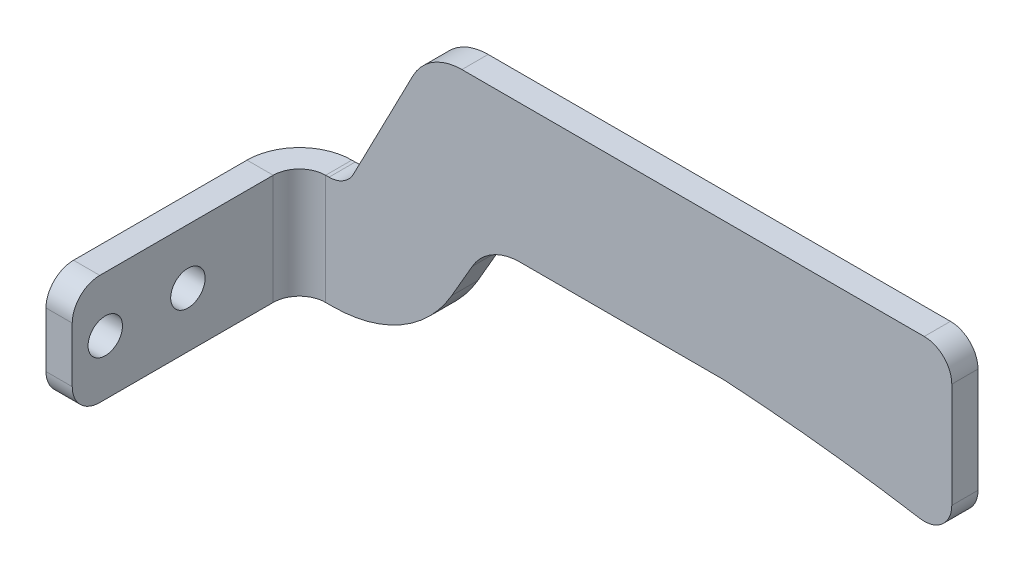
from build123d import *

# Parameters (mm, degrees)
SALIENTE_EXTRUIR1_DEPTH = 6.35
CONVERTIR_S_LIDO1_DEPTH = 1.59
BRIDA_DE_ARISTA1_DEPTH  = 20
REDONDEO1_R             = 5
CORTAR_EXTRUIR1_REACH   = 138.693
CROQUIS11_R             = 3.125


# Read off the part's stored shape, not the designer's step: Convertir-Sólido1
# Sheet-metal steps are written as plain solids
with BuildPart() as part:
    # Croquis1 → Saliente-Extruir1 (new body)
    with BuildSketch(Plane.XY):
        with BuildLine():
            Line((0, 0), (1.21624327, 0))
            ThreePointArc((1.21624327, 0), (13.71624327, 3.349364905), (22.866878365, 12.5))
            Line((22.866878365, 12.5), (26.608548116, 18.980762114))
            ThreePointArc((26.608548116, 18.980762114), (30.268802154, 22.641016151), (35.268802154, 23.980762114))
            Line((35.268802154, 23.980762114), (72.43532503, 23.980762114))
            ThreePointArc((72.43532503, 23.980762114), (90.187263937, 22.435296605), (107.837539609, 19.988345998))
            ThreePointArc((107.837539609, 19.988345998), (111.885560079, 21.109920556), (113.65, 24.921895239))
            Line((113.65, 24.921895239), (113.65, 43.980762114))
            ThreePointArc((113.65, 43.980762114), (112.185533906, 47.516296019), (108.65, 48.980762114))
            Line((108.65, 48.980762114), (24.734232406, 48.980762114))
            ThreePointArc((24.734232406, 48.980762114), (19.536461106, 47.523781106), (15.853300619, 43.577396815))
            Line((15.853300619, 43.577396815), (5.048349691, 22.701682649))
            ThreePointArc((5.048349691, 22.701682649), (3.206769447, 20.728490504), (0.607883797, 20))
            Line((0.607883797, 20), (0, 20))
            Line((0, 20), (0, 0))
        make_face()
    extrude(amount=SALIENTE_EXTRUIR1_DEPTH)

    # Convertir-Sólido1 outline → Convertir-Sólido1 (cut)
    with BuildSketch(Plane.XY):
        with BuildLine():
            Line((0, 20), (0, 0))
            Line((0, 0), (1.21624327, 0))
            ThreePointArc((1.21624327, 0), (13.71624327, 3.349364905), (22.866878365, 12.5))
            Line((22.866878365, 12.5), (26.608548116, 18.980762114))
            ThreePointArc((26.608548116, 18.980762114), (30.268802154, 22.641016151), (35.268802154, 23.980762114))
            Line((35.268802154, 23.980762114), (72.43532503, 23.980762114))
            ThreePointArc((72.43532503, 23.980762114), (90.187263937, 22.435296605), (107.837539609, 19.988345998))
            ThreePointArc((107.837539609, 19.988345998), (111.885560079, 21.109920556), (113.65, 24.921895239))
            Line((113.65, 24.921895239), (113.65, 43.980762114))
            ThreePointArc((113.65, 43.980762114), (112.185533906, 47.516296019), (108.65, 48.980762114))
            Line((108.65, 48.980762114), (24.734232406, 48.980762114))
            ThreePointArc((24.734232406, 48.980762114), (19.536461106, 47.523781106), (15.853300619, 43.577396815))
            Line((15.853300619, 43.577396815), (5.048349691, 22.701682649))
            ThreePointArc((5.048349691, 22.701682649), (3.206769447, 20.728490504), (0.607883797, 20))
            Line((0.607883797, 20), (0, 20))
        make_face()
    extrude(amount=CONVERTIR_S_LIDO1_DEPTH, mode=Mode.SUBTRACT)

    # Brida de arista1 section (across the edge) → Brida de arista1 (add)
    with BuildSketch(Plane(origin=(-4.76, 20, 6.35), x_dir=(1, 0, 0), z_dir=(0, -1, 0))):
        with BuildLine():
            Line((-4.76, 4.76), (-4.76, 41.24))
            Line((-4.76, 41.24), (0, 41.24))
            Line((0, 41.24), (0, 4.76))
            ThreePointArc((0, 4.76), (1.394171722, 1.394171722), (4.76, 0))
            Line((4.76, 0), (4.76, -4.76))
            ThreePointArc((4.76, -4.76), (-1.971656557, -1.971656557), (-4.76, 4.76))
        make_face()
    extrude(amount=BRIDA_DE_ARISTA1_DEPTH)

    # Redondeo1
    redondeo1_edges = [part.edges().sort_by_distance(p)[0] for p in [
        (-7.14, 20, 47.59),
        (-7.14, 0, 47.59),
    ]]
    fillet(redondeo1_edges, radius=REDONDEO1_R)

    # Croquis11 → Cortar-Extruir1 (cut, up to next)
    with BuildSketch(Plane(origin=(-4.76, 0, 0), x_dir=(0, 0, -1), z_dir=(1, 0, 0)), mode=Mode.PRIVATE) as cortar_extruir1_sk1:
        with Locations((-41.59, 10)):
            Circle(CROQUIS11_R)
    cortar_extruir1_tool1 = extrude(cortar_extruir1_sk1.sketch, amount=-CORTAR_EXTRUIR1_REACH, mode=Mode.PRIVATE) & part.part
    # Croquis11 → Cortar-Extruir1 (cut, up to next)
    with BuildSketch(Plane(origin=(-4.76, 0, 0), x_dir=(0, 0, -1), z_dir=(1, 0, 0)), mode=Mode.PRIVATE) as cortar_extruir1_sk2:
        with Locations((-26.59, 10)):
            Circle(CROQUIS11_R)
    cortar_extruir1_tool2 = extrude(cortar_extruir1_sk2.sketch, amount=-CORTAR_EXTRUIR1_REACH, mode=Mode.PRIVATE) & part.part
    add(cortar_extruir1_tool1.solids().sort_by_distance((-4.76, 10, 41.59))[0], mode=Mode.SUBTRACT)
    add(cortar_extruir1_tool2.solids().sort_by_distance((-4.76, 10, 26.59))[0], mode=Mode.SUBTRACT)


solid = part.part
